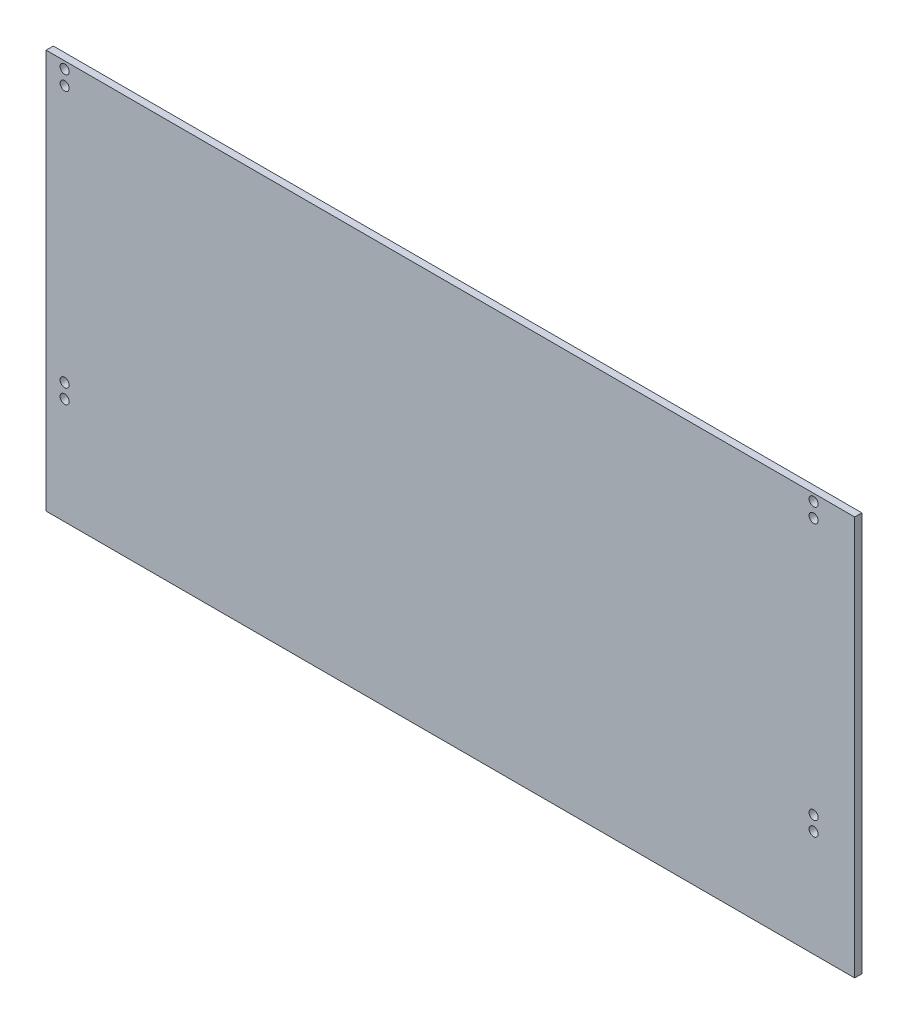
from build123d import *

# Parameters (mm, degrees)
SKETCH1_W           = 357.55
SKETCH1_H           = 176.55
BOSS_EXTRUDE1_DEPTH = 3.175
SKETCH2_R           = 2
CUT_EXTRUDE1_DEPTH  = 200.40676236


with BuildPart() as part:
    # Sketch1 → Boss-Extrude1 (new body)
    with BuildSketch(Plane.XY):
        Rectangle(SKETCH1_W, SKETCH1_H)
    extrude(amount=BOSS_EXTRUDE1_DEPTH)

    # Sketch2 → Cut-Extrude1 (cut, through all)
    with BuildSketch(Plane(origin=(0, 0, 0), x_dir=(-1, 0, 0), z_dir=(0, 0, -1))):
        with Locations((170.599999935, 85.1)):
            Circle(SKETCH2_R)
        with Locations((170.599999935, 78.75)):
            Circle(SKETCH2_R)
        with Locations((170.599999935, -34.9)):
            Circle(SKETCH2_R)
        with Locations((170.599999935, -41.25)):
            Circle(SKETCH2_R)
        with Locations((-160.599999965, 85.1)):
            Circle(SKETCH2_R)
        with Locations((-160.599999965, 78.75)):
            Circle(SKETCH2_R)
        with Locations((-160.599999965, -34.9)):
            Circle(SKETCH2_R)
        with Locations((-160.599999965, -41.25)):
            Circle(SKETCH2_R)
    extrude(amount=-CUT_EXTRUDE1_DEPTH, mode=Mode.SUBTRACT)


solid = part.part
